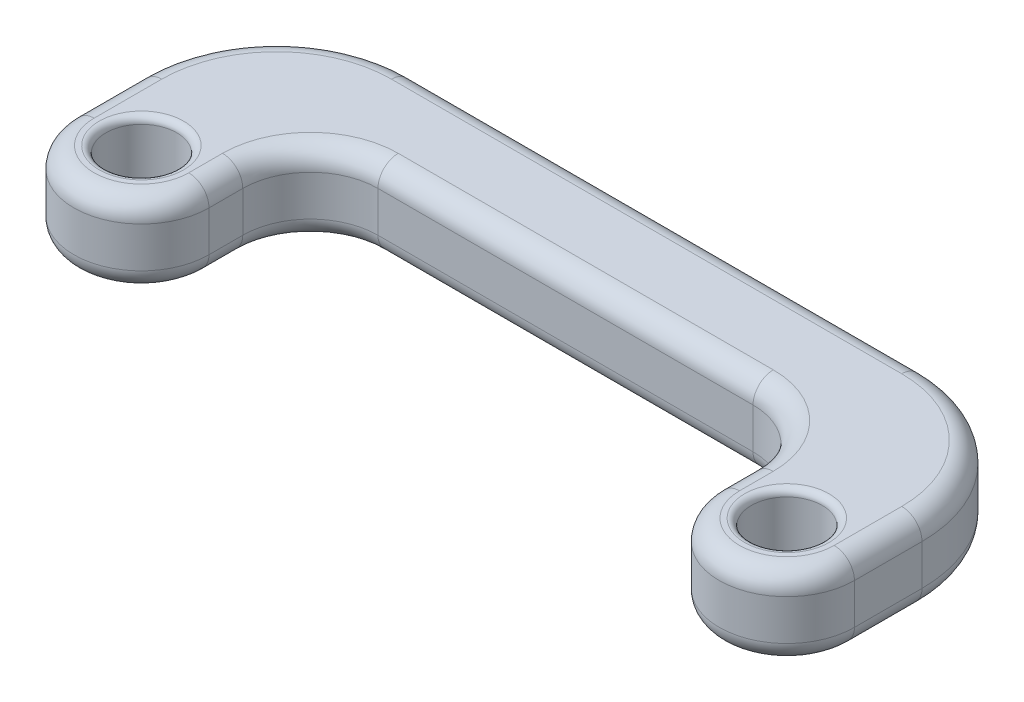
from build123d import *

# Parameters (mm, degrees)
SKETCH7_R           = 5
BOSS_EXTRUDE5_DEPTH = 12
FILLET2_R           = 20
FILLET3_R           = 10
FILLET5_R           = 3
SKETCH11_R          = 5.25
CUT_EXTRUDE1_DEPTH  = 25
FILLET6_R           = 1


with BuildPart() as part:
    # Sketch7 → Boss-Extrude5 (new body)
    with BuildSketch(Plane(origin=(0, 0, 0), x_dir=(1, 0, 0), z_dir=(0, 1, 0))):
        with BuildLine():
            Line((-105.5, 30), (-105.5, 0))
            ThreePointArc((-105.5, 0), (-95.5, -10), (-85.5, 0))
            Line((-85.5, 0), (-85.5, 15))
            Line((-85.5, 15), (-10, 15))
            Line((-10, 15), (-10, 0))
            ThreePointArc((-10, 0), (0, -10), (10, 0))
            Line((10, 0), (10, 30))
            Line((10, 30), (-10, 30))
            Line((-10, 30), (-85.5, 30))
            Line((-85.5, 30), (-105.5, 30))
        make_face()
        with Locations((-95.5, 0)):
            Circle(SKETCH7_R, mode=Mode.SUBTRACT)
    extrude(amount=BOSS_EXTRUDE5_DEPTH)

    # Fillet2
    fillet2_edges = [part.edges().sort_by_distance(p)[0] for p in [
        (10, 6, -30),
        (-105.5, 6, -30),
    ]]
    fillet(fillet2_edges, radius=FILLET2_R)

    # Fillet3
    fillet3_edges = [part.edges().sort_by_distance(p)[0] for p in [
        (-10, 6, -15),
        (-85.5, 6, -15),
    ]]
    fillet(fillet3_edges, radius=FILLET3_R)

    # Fillet5
    fillet5_edges = [part.edges().sort_by_distance(p)[0] for p in [
        (-47.75, 12, -30),
        (4.142135624, 12, -24.142135624),
        (10, 12, -5),
        (0, 12, 10),
        (-10, 12, -2.5),
        (-12.928932188, 12, -12.071067812),
        (-47.75, 12, -15),
        (-82.571067812, 12, -12.071067812),
        (-85.5, 12, -2.5),
        (-95.5, 12, 10),
        (-105.5, 12, -5),
        (-105.5, 0, -5),
        (-95.5, 0, 10),
        (-85.5, 0, -2.5),
        (-82.571067812, 0, -12.071067812),
        (-47.75, 0, -15),
        (-12.928932188, 0, -12.071067812),
        (-10, 0, -2.5),
        (0, 0, 10),
        (10, 0, -5),
        (4.142135624, 0, -24.142135624),
        (-47.75, 0, -30),
        (-99.642135624, 12, -24.142135624),
        (-99.642135624, 0, -24.142135624),
    ]]
    fillet(fillet5_edges, radius=FILLET5_R)

    # Sketch11 → Cut-Extrude1 (cut)
    with BuildSketch(Plane.XZ):
        with Locations((-95.5, 0)):
            Circle(SKETCH11_R)
        Circle(SKETCH11_R)
    extrude(amount=-CUT_EXTRUDE1_DEPTH, mode=Mode.SUBTRACT)

    # Fillet6
    fillet6_edges = [part.edges().sort_by_distance(p)[0] for p in [
        (-100.75, 12, 0),
        (-100.75, 0, 0),
        (-5.25, 12, 0),
        (-5.25, 0, 0),
    ]]
    fillet(fillet6_edges, radius=FILLET6_R)


solid = part.part
